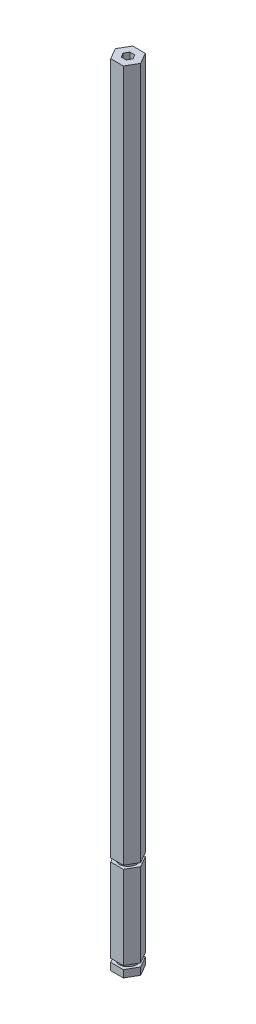
from build123d import *

# Parameters (mm, degrees)
BOSS_EXTRUDE1_DEPTH = 457.2
SKETCH3_W           = 2.54
SKETCH3_H           = 2.032


with BuildPart() as part:
    # Sketch1 → Boss-Extrude1 (new body)
    with BuildSketch(Plane(origin=(0, 0, 0), x_dir=(1, 0, 0), z_dir=(0, 1, 0))):
        Polygon((7.332348419, 0), (3.666174209, 6.35), (-3.666174209, 6.35), (-7.332348419, 0), (-3.666174209, -6.35), (3.666174209, -6.35), align=None)
        Polygon((1.443375673, 2.5), (-1.443375673, 2.5), (-2.886751346, 0), (-1.443375673, -2.5), (1.443375673, -2.5), (2.886751346, 0), align=None, mode=Mode.SUBTRACT)
    extrude(amount=BOSS_EXTRUDE1_DEPTH)

    # Sketch3 → Cut-Revolve2 (revolve, cut)
    with BuildSketch(Plane(origin=(0, 0, 0), x_dir=(0, 0, -1), z_dir=(1, 0, 0))):
        with Locations((6.2865, 55.499)):
            Rectangle(SKETCH3_W, SKETCH3_H)
        with Locations((6.2865, 5.207)):
            Rectangle(SKETCH3_W, SKETCH3_H)
    revolve(axis=Axis((0, 457.2, 0), (0, -1, 0)), mode=Mode.SUBTRACT)


solid = part.part
